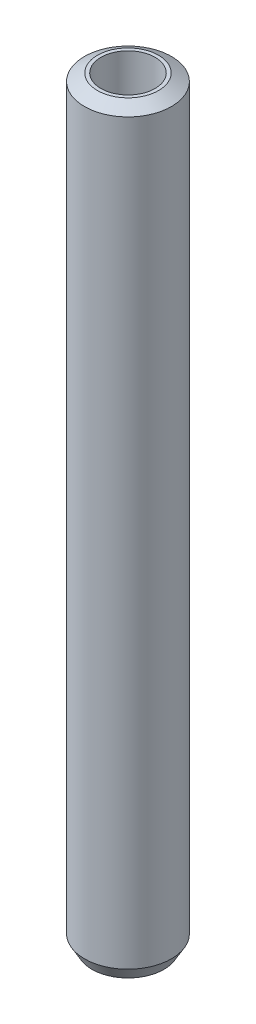
from build123d import *
from OCP.BRepFilletAPI import BRepFilletAPI_MakeChamfer

# Parameters (mm, degrees)
SKETCH1_R           = 32.5
BOSS_EXTRUDE1_DEPTH = 567.153264696
SKETCH2_R           = 20.24955941
CUT_EXTRUDE1_DEPTH  = 570.01258831
CHAMFER1_SIZE       = 5.556594904
CHAMFER1_SIZE2      = 9.624304691


with BuildPart() as part:
    # Sketch1 → Boss-Extrude1 (new body)
    with BuildSketch(Plane(origin=(0, 0, 0), x_dir=(1, 0, 0), z_dir=(0, 1, 0))):
        Circle(SKETCH1_R)
    extrude(amount=BOSS_EXTRUDE1_DEPTH)

    # Sketch2 → Cut-Extrude1 (cut, through all)
    with BuildSketch(Plane(origin=(0, 0, 0), x_dir=(1, 0, 0), z_dir=(0, 1, 0))):
        Circle(SKETCH2_R)
    extrude(amount=CUT_EXTRUDE1_DEPTH, mode=Mode.SUBTRACT)

    # Chamfer1: one chamfer whose edges measure the first distance from different faces: ONE call of the kernel's chamfer builder (chamfer() names one face for all edges)
    chamfer1_edges_1 = [part.edges().sort_by_distance(p)[0] for p in [
        (-32.5, 567.153264696, 0),
    ]]
    chamfer1_side_1 = [part.faces().sort_by_distance(p)[0] for p in [
        (-32.5, 283.576632348, 0),
    ]]
    chamfer1_edges_2 = [part.edges().sort_by_distance(p)[0] for p in [
        (-32.5, 0, 0),
    ]]
    chamfer1_side_2 = [part.faces().sort_by_distance(p)[0] for p in [
        (-31.580761184, 0, 0),
    ]]
    chamfer1 = BRepFilletAPI_MakeChamfer(part.part.solid().wrapped)
    for e in chamfer1_edges_1:
        chamfer1.Add(CHAMFER1_SIZE, CHAMFER1_SIZE2, e.wrapped, chamfer1_side_1[0].wrapped)  # the first distance lies on this face
    for e in chamfer1_edges_2:
        chamfer1.Add(CHAMFER1_SIZE, CHAMFER1_SIZE2, e.wrapped, chamfer1_side_2[0].wrapped)  # the first distance lies on this face
    add(Compound.cast(chamfer1.Shape()), mode=Mode.REPLACE)


solid = part.part
